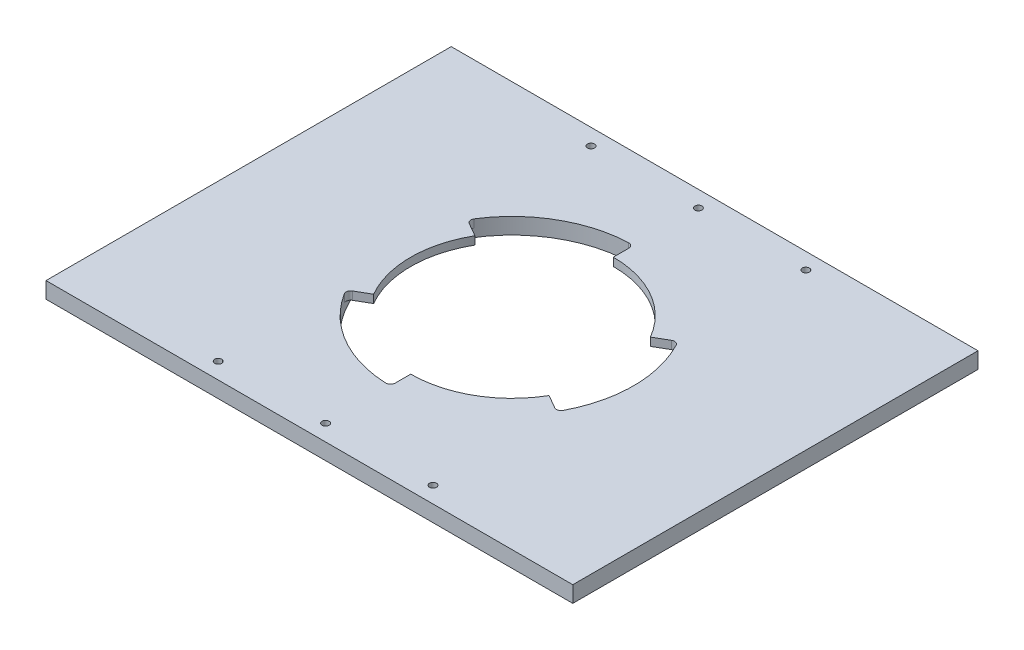
from build123d import *

# Parameters (mm, degrees)
SKIZZE1_W                       = 260
SKIZZE1_H                       = 200
SKIZZE1_R                       = 1.749999999999997
SKIZZE1_R_2                     = 1.7500000000000038
SKIZZE1_R_3                     = 1.7500000000000042
AUFSATZ_LINEAR_AUSTRAGEN1_DEPTH = 8
SKIZZE2_R                       = 50
SCHNITT_LINEAR_AUSTRAGEN1_DEPTH = 8
SCHNITT_LINEAR_AUSTRAGEN4_DEPTH = 165.2071862008481
SCHNITT_LINEAR_AUSTRAGEN5_DEPTH = 4
VERRUNDUNG1_R                   = 2.3


with BuildPart() as part:
    # Skizze1 → Aufsatz-Linear austragen1 (new body)
    with BuildSketch(Plane(origin=(0, 0, 0), x_dir=(1, 0, 0), z_dir=(0, 1, 0))):
        Rectangle(SKIZZE1_W, SKIZZE1_H)
        with Locations(Location((-53, -92, 0), (0, 0, 270))):
            Circle(SKIZZE1_R, mode=Mode.SUBTRACT)
        with Locations(Location((53, -92, 0), (0, 0, 270))):
            Circle(SKIZZE1_R_2, mode=Mode.SUBTRACT)
        with Locations(Location((0, -92, 0), (0, 0, 270))):
            Circle(SKIZZE1_R_3, mode=Mode.SUBTRACT)
        with Locations(Location((-5.551e-14, 91.99999999999991, 0), (0, 0, 90))):
            Circle(SKIZZE1_R_3, mode=Mode.SUBTRACT)
        with Locations(Location((52.99999999999994, 91.99999999999991, 0), (0, 0, 90))):
            Circle(SKIZZE1_R_2, mode=Mode.SUBTRACT)
        with Locations(Location((-53.00000000000003, 91.99999999999989, 0), (0, 0, 90))):
            Circle(SKIZZE1_R, mode=Mode.SUBTRACT)
    extrude(amount=AUFSATZ_LINEAR_AUSTRAGEN1_DEPTH)

    # Skizze2 → Schnitt-Linear austragen1 (cut)
    with BuildSketch(Plane(origin=(0, 8, 0), x_dir=(1, 0, 0), z_dir=(0, 1, 0))):
        with Locations(Location((0, 0, 0), (0, 0, 270))):
            Circle(SKIZZE2_R)
    extrude(amount=-SCHNITT_LINEAR_AUSTRAGEN1_DEPTH, mode=Mode.SUBTRACT)

    # Skizze3 → Schnitt-Linear austragen4 (cut, through all)
    with BuildSketch(Plane.XZ):
        with BuildLine():
            ThreePointArc((60.00000000000001, 0), (59.947803224682126, 2.5021767593021864), (59.79130371550694, 5.000000000000675))
            Line((59.791303715506885, 5), (49.749371855331, 5))
            ThreePointArc((49.749371855331006, 5.000000000000001), (49.937303655516644, 2.503138752990944), (50.00000000000001, 0))
            ThreePointArc((50.00000000000001, -1.225e-14), (49.937303655516644, -2.503138752990955), (49.749371855331006, -5.00000000000001))
            Line((49.749371855331, -5), (59.791303715506885, -5))
            ThreePointArc((59.79130371550694, -5.0000000000006795), (59.947803224682126, -2.5021767593021957), (60.00000000000001, -1.47e-14))
        make_face()
        with BuildLine():
            ThreePointArc((59.79130371550694, 5.000000000000675), (57.257520364495285, 17.932550340356187), (51.961524227066455, 29.99999999999978))
            Line((51.961524227066455, 29.99999999999978), (43.30127018922205, 24.999999999999826))
            ThreePointArc((43.301270189222045, 24.999999999999822), (47.58787131429482, 15.342571615414302), (49.749371855331006, 5.000000000000001))
            Line((49.749371855331, 5), (59.791303715506885, 5))
        make_face()
        with BuildLine():
            Line((59.791303715506885, -5), (49.749371855331, -5))
            ThreePointArc((49.749371855331006, -5.00000000000001), (47.58787131429479, -15.342571615414398), (43.301270189221945, -24.999999999999986))
            Line((43.301270189221945, -24.999999999999993), (51.961524227066334, -29.999999999999993))
            ThreePointArc((51.961524227066334, -29.999999999999982), (57.25752036449525, -17.932550340356304), (59.79130371550694, -5.0000000000006795))
        make_face()
        with BuildLine():
            Line((-43.30127018922192, -25.00000000000002), (-51.961524227066306, -30.00000000000003))
            ThreePointArc((-51.96152422706632, -30.00000000000001), (-30.000000000000117, -51.961524227066256), (-2.7748e-13, -60.00000000000001))
            Line((-2.4633e-13, -60.00000000000001), (-1.9949e-13, -50.00000000000001))
            ThreePointArc((-1.8682e-13, -50.00000000000001), (-25.000000000000064, -43.3012701892219), (-43.30127018922194, -25.00000000000001))
        make_face()
        with BuildLine():
            ThreePointArc((3.67e-15, 60.00000000000001), (-29.999999999999876, 51.9615242270664), (-51.961524227066185, 30.000000000000256))
            Line((-51.961524227066185, 30.000000000000245), (-43.30127018922183, 25.0000000000002))
            ThreePointArc((-43.30127018922182, 25.000000000000213), (-24.999999999999897, 43.301270189221995), (3.06e-15, 50.00000000000001))
            Line((0, 50), (0, 60.00000000000001))
        make_face()
    extrude(amount=-SCHNITT_LINEAR_AUSTRAGEN4_DEPTH, mode=Mode.SUBTRACT)

    # Skizze3<5> → Schnitt-Linear austragen5 (cut)
    with BuildSketch(Plane.XZ):
        with BuildLine():
            Line((70.25062814466901, 5), (59.791303715506885, 5))
            ThreePointArc((59.79130371550694, 5.000000000000675), (59.947803224682126, 2.5021767593021864), (60.00000000000001, 0))
            ThreePointArc((60.00000000000001, -1.47e-14), (59.947803224682126, -2.5021767593021957), (59.79130371550694, -5.0000000000006795))
            Line((59.791303715506885, -5), (70.25062814466901, -5))
            Line((70.25062814466901, -5), (70.25062814466901, 5))
        make_face()
        with BuildLine():
            ThreePointArc((-59.79130371550711, -4.999999999998586), (-60.00000000000001, 7.35e-15), (-59.79130371550711, 4.999999999998601))
            Line((-59.791303715507226, 5), (-70.25062814466901, 5))
            Line((-70.25062814466901, 5), (-70.25062814466901, -5))
            Line((-70.25062814466901, -5), (-59.791303715507226, -5))
        make_face()
        with BuildLine():
            Line((-49.749371855331, -5), (-59.791303715507226, -5))
            ThreePointArc((-59.79130371550711, -4.999999999998586), (-57.257520364495555, -17.932550340355316), (-51.96152422706632, -30.00000000000001))
            Line((-51.961524227066306, -30.00000000000003), (-43.30127018922192, -25.00000000000002))
            ThreePointArc((-43.30127018922194, -25.00000000000001), (-47.58787131429479, -15.342571615414402), (-49.749371855331006, -4.999999999999992))
        make_face()
        with BuildLine():
            Line((-49.749371855331, 5), (-59.791303715507226, 5))
            ThreePointArc((-59.79130371550711, 4.999999999998601), (-60.00000000000001, 7.35e-15), (-59.79130371550711, -4.999999999998586))
            Line((-59.791303715507226, -5), (-49.749371855331, -5))
            ThreePointArc((-49.749371855331006, -4.999999999999992), (-50.00000000000001, 6.12e-15), (-49.749371855331006, 5.000000000000004))
        make_face()
        with BuildLine():
            Line((-43.30127018922183, 25.0000000000002), (-51.961524227066185, 30.000000000000245))
            ThreePointArc((-51.961524227066185, 30.000000000000256), (-57.25752036449551, 17.932550340355455), (-59.79130371550711, 4.999999999998601))
            Line((-59.791303715507226, 5), (-49.749371855331, 5))
            ThreePointArc((-49.749371855331006, 5.000000000000004), (-47.58787131429475, 15.342571615414519), (-43.30127018922182, 25.000000000000213))
        make_face()
        with BuildLine():
            ThreePointArc((51.961524227066455, 29.99999999999978), (30.00000000000011, 51.96152422706626), (3.67e-15, 60.00000000000001))
            Line((0, 60.00000000000001), (0, 50))
            ThreePointArc((3.06e-15, 50.00000000000001), (25.000000000000092, 43.30127018922189), (43.301270189222045, 24.99999999999982))
            Line((43.30127018922205, 24.999999999999826), (51.961524227066455, 29.99999999999978))
        make_face()
        with BuildLine():
            Line((-1.9949e-13, -50.00000000000001), (-2.4633e-13, -60.00000000000001))
            ThreePointArc((-2.7748e-13, -60.00000000000001), (29.99999999999987, -51.9615242270664), (51.961524227066334, -29.999999999999982))
            Line((51.961524227066334, -29.999999999999993), (43.301270189221945, -24.999999999999993))
            ThreePointArc((43.301270189221945, -24.999999999999986), (24.999999999999932, -43.30127018922198), (-1.8682e-13, -50.00000000000001))
        make_face()
    extrude(amount=-SCHNITT_LINEAR_AUSTRAGEN5_DEPTH, mode=Mode.SUBTRACT)

    # Verrundung1
    # the kernel refuses this fillet: 2.3 mm, written as the material it adds along each edge
    with BuildSketch(Plane(origin=(70.25062814466901, 0, 5), x_dir=(0, 0, -1), z_dir=(0, 1, 0))) as verrundung1_piece_1:
        with BuildLine():
            CenterArc((VERRUNDUNG1_R, VERRUNDUNG1_R), VERRUNDUNG1_R, 180, 90)
            Line((-8.9e-16, VERRUNDUNG1_R), (0, 0))
            Line((0, 0), (VERRUNDUNG1_R, 0))
        make_face()
    extrude(amount=4)
    with BuildSketch(Plane(origin=(70.25062814466901, 0, -5), x_dir=(-1, 0, 0), z_dir=(0, 1, 0))) as verrundung1_piece_2:
        with BuildLine():
            CenterArc((VERRUNDUNG1_R, VERRUNDUNG1_R), VERRUNDUNG1_R, 180, 90)
            Line((0, VERRUNDUNG1_R), (0, 0))
            Line((0, 0), (VERRUNDUNG1_R, 0))
        make_face()
    extrude(amount=4)
    with BuildSketch(Plane(origin=(-70.25062814466901, 0, -5), x_dir=(1, 0, 0), z_dir=(0, 1, 0))) as verrundung1_piece_3:
        with BuildLine():
            CenterArc((VERRUNDUNG1_R, -VERRUNDUNG1_R), VERRUNDUNG1_R, 90, 89.99999999999997)
            Line((0, -VERRUNDUNG1_R), (0, 0))
            Line((0, 0), (VERRUNDUNG1_R, 0))
        make_face()
    extrude(amount=4)
    with BuildSketch(Plane(origin=(-70.25062814466901, 0, 5), x_dir=(0, 0, -1), z_dir=(0, 1, 0))) as verrundung1_piece_4:
        with BuildLine():
            CenterArc((VERRUNDUNG1_R, -VERRUNDUNG1_R), VERRUNDUNG1_R, 90, 90)
            Line((0, -VERRUNDUNG1_R), (0, 0))
            Line((0, 0), (VERRUNDUNG1_R, 0))
        make_face()
    extrude(amount=4)
    with BuildSketch(Plane(origin=(51.96152422706646, 4, 29.99999999999978), x_dir=(0.48263674044551186, 0, -0.8758206304787137), z_dir=(0, 1, 0))) as verrundung1_piece_5:
        with BuildLine():
            CenterArc((2.346306800066914, 2.2995429563643968), VERRUNDUNG1_R, 178.8577537601654, 92.2844924796575)
            Line((0.04676384370252609, 2.345392621956658), (0, 0))
            ThreePointArc((0, 0), (1.1960782328293844, -0.01192287745045764), (2.392156465658705, -7e-17))
        make_face()
    extrude(amount=4)
    with BuildSketch(Plane(origin=(51.961524227066334, 4, -29.99999999999999), x_dir=(-0.8660254037844398, 0, 0.499999999999998), z_dir=(0, 1, 0))) as verrundung1_piece_6:
        with BuildLine():
            CenterArc((2.345858778401576, 2.2999999999999994), VERRUNDUNG1_R, 177.71550752035841, 92.2844924796417)
            ThreePointArc((0.04768677130146285, 2.3916811091852797), (0.011922877450426, 1.1960782328291542), (0, 0))
            Line((0, 0), (2.34585877840158, -4e-17))
        make_face()
    extrude(amount=4)
    with BuildSketch(Plane(origin=(-51.96152422706631, 4, -30.00000000000002), x_dir=(0.8660254037844404, 0, 0.49999999999999717), z_dir=(0, 1, 0))) as verrundung1_piece_7:
        with BuildLine():
            CenterArc((2.3458587784015195, 2.2999999999999994), VERRUNDUNG1_R, 177.71550752035327, 92.28449247964659)
            ThreePointArc((0.04768677130141288, 2.3916811091854857), (0.01192287745041601, 1.196078232829249), (0, 0))
            Line((0, 0), (2.3458587784015132, -4e-17))
        make_face()
    extrude(amount=4)
    with BuildSketch(Plane(origin=(-2.6083e-13, 4, -60), x_dir=(1.086e-14, 0, 1), z_dir=(0, 1, 0))) as verrundung1_piece_8:
        with BuildLine():
            CenterArc((2.3458587784010057, -2.3), VERRUNDUNG1_R, 89.99999999999973, 92.28449247964573)
            ThreePointArc((0.04768677130089817, -2.3916811091854364), (0.01192287745039645, -1.1960782328292843), (0, 0))
            Line((0, 0), (2.3458587784010163, 0))
        make_face()
    extrude(amount=4)
    with BuildSketch(Plane(origin=(1.84e-15, 4, 60.00000000000001), x_dir=(-7.8e-16, 0, -1), z_dir=(0, 1, 0))) as verrundung1_piece_9:
        with BuildLine():
            CenterArc((2.3458587784015865, 2.3), VERRUNDUNG1_R, 177.71550752035446, 92.28449247964545)
            ThreePointArc((0.04768677130148023, 2.3916811091854395), (0.011922877450453, 1.1960782328292412), (0, 0))
            Line((0, 0), (2.3458587784015847, 0))
        make_face()
    extrude(amount=4)
    with BuildSketch(Plane(origin=(-51.961524227066185, 4, 30.00000000000025), x_dir=(0.8660254037844354, 0, -0.5000000000000054), z_dir=(0, 1, 0))) as verrundung1_piece_10:
        with BuildLine():
            CenterArc((2.3458587784015092, -2.3), VERRUNDUNG1_R, 90, 92.28449247965011)
            ThreePointArc((0.04768677130141038, -2.3916811091856207), (0.0119228774504358, -1.1960782328293367), (0, 0))
            Line((0, 0), (2.3458587784015092, -2e-16))
        make_face()
    extrude(amount=4)


solid = part.part
